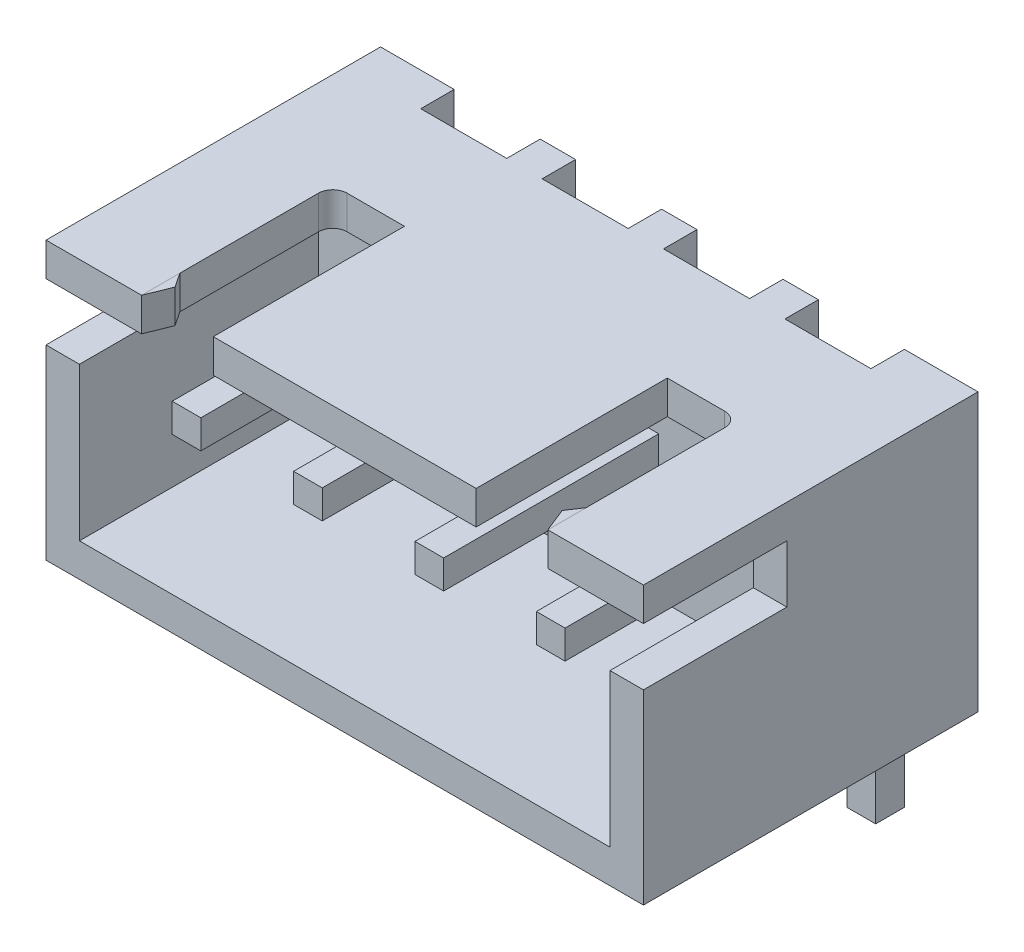
from build123d import *

# Parameters (mm, degrees)
SKETCH_1_W          = 12.5
SKETCH_1_H          = 5.8
EXTRUDE_1_DEPTH     = 7
SKETCH_2_W          = 11.1
SKETCH_2_H          = 4.4
CUT_EXTRUDE_1_DEPTH = 5
SKETCH_3_W          = 0.7
SKETCH_3_H          = 1.2
CUT_EXTRUDE_2_DEPTH = 3
SKETCH_4_W          = 1.5
SKETCH_4_H          = 0.7
CUT_EXTRUDE_3_DEPTH = 4
FILLET_1_R          = 0.3
EXTRUDE_2_DEPTH     = 0.7
EXTRUDE_2_2_DEPTH   = 0.7
SKETCH_6_W          = 0.6
SKETCH_6_H          = 0.6
EXTRUDE_3_DEPTH     = 4.5
SKETCH_7_W          = 1.8
SKETCH_7_H          = 5.8
CUT_EXTRUDE_4_DEPTH = 0.2
SKETCH_8_W          = 0.6
SKETCH_8_H          = 0.6
EXTRUDE_4_DEPTH     = 0.2
SKETCH_9_W          = 0.6
SKETCH_9_H          = 6.8
EXTRUDE_5_DEPTH     = 0.6
FILLET_2_R          = 0.3
FILLET_3_R          = 0.2
CHAMFER_1_SIZE      = 0.5
CHAMFER_1_SIZE2     = 1.5
CHAMFER_2_SIZE      = 0.5
CHAMFER_2_SIZE2     = 2.5


with BuildPart() as part:
    # 草图1 → 凸台-拉伸1 (new body)
    with BuildSketch(Plane.XY):
        Rectangle(SKETCH_1_W, SKETCH_1_H)
    extrude(amount=EXTRUDE_1_DEPTH)

    # 草图2 → 切除-拉伸1 (cut)
    with BuildSketch(Plane.XY.offset(7)):
        Rectangle(SKETCH_2_W, SKETCH_2_H)
    extrude(amount=-CUT_EXTRUDE_1_DEPTH, mode=Mode.SUBTRACT)

    # 草图3 → 切除-拉伸2 (cut)
    with BuildSketch(Plane.XY.offset(7)):
        with Locations((-5.9, 1.6)):
            Rectangle(SKETCH_3_W, SKETCH_3_H)
        with Locations((5.9, 1.6)):
            Rectangle(SKETCH_3_W, SKETCH_3_H)
    extrude(amount=-CUT_EXTRUDE_2_DEPTH, mode=Mode.SUBTRACT)

    # 草图4 → 切除-拉伸3 (cut)
    with BuildSketch(Plane.XY.offset(7)):
        with Locations((-3.5, 2.55)):
            Rectangle(SKETCH_4_W, SKETCH_4_H)
        with Locations((3.5, 2.55)):
            Rectangle(SKETCH_4_W, SKETCH_4_H)
    extrude(amount=-CUT_EXTRUDE_3_DEPTH, mode=Mode.SUBTRACT)

    # 圆角1
    fillet_1_edges = [part.edges().sort_by_distance(p)[0] for p in [
        (-4.25, 2.55, 3),
        (4.25, 2.55, 3),
    ]]
    fillet(fillet_1_edges, radius=FILLET_1_R)

    # 草图6 → 凸台-拉伸3 (add)
    with BuildSketch(Plane.XY.offset(2)):
        with Locations((-3.81, 0.5)):
            Rectangle(SKETCH_6_W, SKETCH_6_H)
        with Locations((-1.27, 0.5)):
            Rectangle(SKETCH_6_W, SKETCH_6_H)
        with Locations((1.27, 0.5)):
            Rectangle(SKETCH_6_W, SKETCH_6_H)
        with Locations((3.81, 0.5)):
            Rectangle(SKETCH_6_W, SKETCH_6_H)
    extrude(amount=EXTRUDE_3_DEPTH)

    # 草图7 → 切除-拉伸4 (cut)
    with BuildSketch(Plane(origin=(0, 0, 0), x_dir=(-1, 0, 0), z_dir=(0, 0, -1))):
        with Locations((-3.81, 0)):
            Rectangle(SKETCH_7_W, SKETCH_7_H)
        with Locations((-1.27, 0)):
            Rectangle(SKETCH_7_W, SKETCH_7_H)
        with Locations((1.27, 0)):
            Rectangle(SKETCH_7_W, SKETCH_7_H)
        with Locations((3.81, 0)):
            Rectangle(SKETCH_7_W, SKETCH_7_H)
    extrude(amount=-CUT_EXTRUDE_4_DEPTH, mode=Mode.SUBTRACT)

    # 草图8 → 凸台-拉伸4 (add)
    with BuildSketch(Plane(origin=(0, 0, 0.2), x_dir=(-1, 0, 0), z_dir=(0, 0, -1))):
        with Locations((-3.808858408, 0.5)):
            Rectangle(SKETCH_8_W, SKETCH_8_H)
        with Locations((-1.268858408, 0.5)):
            Rectangle(SKETCH_8_W, SKETCH_8_H)
        with Locations((1.268858408, 0.5)):
            Rectangle(SKETCH_8_W, SKETCH_8_H)
        with Locations((3.808858408, 0.5)):
            Rectangle(SKETCH_8_W, SKETCH_8_H)
    extrude(amount=EXTRUDE_4_DEPTH)

    # 草图9 → 凸台-拉伸5 (add)
    with BuildSketch(Plane(origin=(0, 0, 0), x_dir=(-1, 0, 0), z_dir=(0, 0, -1))):
        with Locations((-3.808858408, -2.6)):
            Rectangle(SKETCH_9_W, SKETCH_9_H)
        with Locations((-1.268858408, -2.6)):
            Rectangle(SKETCH_9_W, SKETCH_9_H)
        with Locations((1.268858408, -2.6)):
            Rectangle(SKETCH_9_W, SKETCH_9_H)
        with Locations((3.808858408, -2.6)):
            Rectangle(SKETCH_9_W, SKETCH_9_H)
    extrude(amount=EXTRUDE_5_DEPTH)

    # 圆角2
    fillet_2_edges = [part.edges().sort_by_distance(p)[0] for p in [
        (3.808858408, 0.8, -0.6),
        (1.268858408, 0.8, -0.6),
        (-1.268858408, 0.8, -0.6),
        (-3.808858408, 0.8, -0.6),
    ]]
    fillet(fillet_2_edges, radius=FILLET_2_R)

    # 圆角3
    fillet_3_edges = [part.edges().sort_by_distance(p)[0] for p in [
        (-3.808858408, 0.2, 0),
        (-1.268858408, 0.2, 0),
        (1.268858408, 0.2, 0),
        (3.808858408, 0.2, 0),
    ]]
    fillet(fillet_3_edges, radius=FILLET_3_R - 0.0001)  # a hair under: the kernel refuses the full size

    # 倒角1
    chamfer_1_edges = [part.edges().sort_by_distance(p)[0] for p in [
        (3.81, 2.9, 0.2),
        (1.27, 2.9, 0.2),
        (-1.27, 2.9, 0.2),
        (-3.81, 2.9, 0.2),
    ]]
    chamfer_1_side = [part.faces().sort_by_distance(p)[0] for p in [
        (0, 2.9, 3.322928899),
    ]]
    chamfer(chamfer_1_edges, length=CHAMFER_1_SIZE, length2=CHAMFER_1_SIZE2, reference=chamfer_1_side[0])

    # 倒角2
    chamfer_2_edges = [part.edges().sort_by_distance(p)[0] for p in [
        (3.81, -2.9, 0.2),
        (1.27, -2.9, 0.2),
        (-1.27, -2.9, 0.2),
        (-3.81, -2.9, 0.2),
    ]]
    chamfer_2_side = [part.faces().sort_by_distance(p)[0] for p in [
        (0, -2.9, 3.556890541),
    ]]
    chamfer(chamfer_2_edges, length=CHAMFER_2_SIZE, length2=CHAMFER_2_SIZE2, reference=chamfer_2_side[0])


with BuildPart() as body_2:
    # 草图5 → 凸台-拉伸2 (new body)
    with BuildSketch(Plane(origin=(0, 2.9, 0), x_dir=(1, 0, 0), z_dir=(0, 1, 0))):
        Polygon((-4.25, -7), (-4.25, -6.2), (-4.05, -6.5), align=None)
    extrude(amount=-EXTRUDE_2_DEPTH)


with BuildPart() as body_3:
    # 草图5 → Extrude 2 2 (new body)
    with BuildSketch(Plane(origin=(0, 2.9, 0), x_dir=(1, 0, 0), z_dir=(0, 1, 0))):
        Polygon((4.05, -6.5), (4.25, -7), (4.25, -6.2), align=None)
    extrude(amount=-EXTRUDE_2_2_DEPTH)


solid = Compound([part.part, body_2.part, body_3.part])
